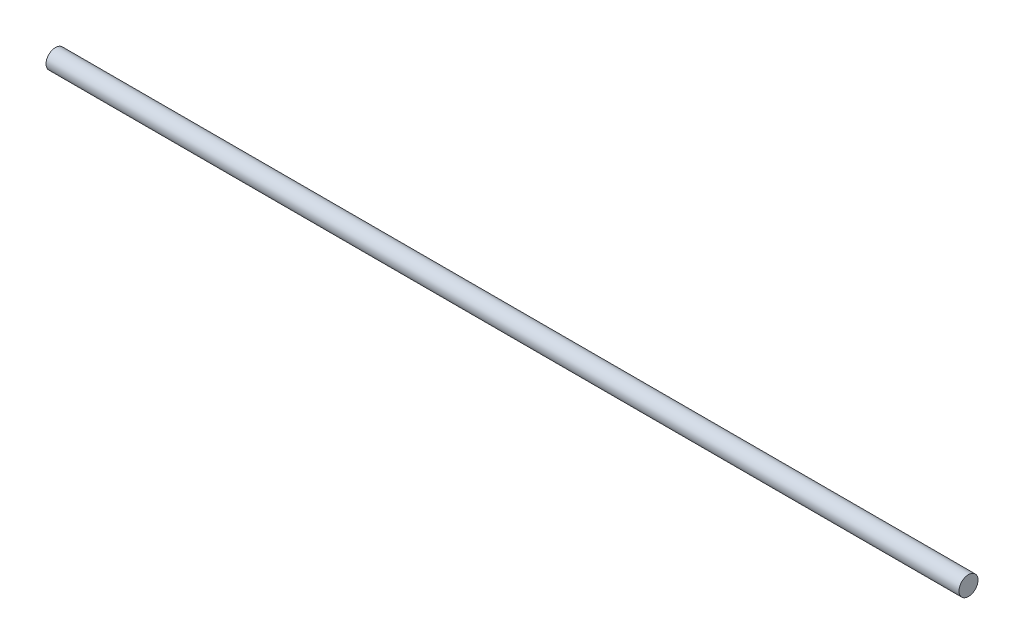
from build123d import *

# Parameters (mm, degrees)
SKETCH1_R           = 1.5875
BOSS_EXTRUDE1_DEPTH = 152.4


with BuildPart() as part:
    # Sketch1 → Boss-Extrude1 (new body)
    with BuildSketch(Plane(origin=(0, 0, 0), x_dir=(0, 0, -1), z_dir=(1, 0, 0))):
        Circle(SKETCH1_R)
    extrude(amount=BOSS_EXTRUDE1_DEPTH)


solid = part.part
